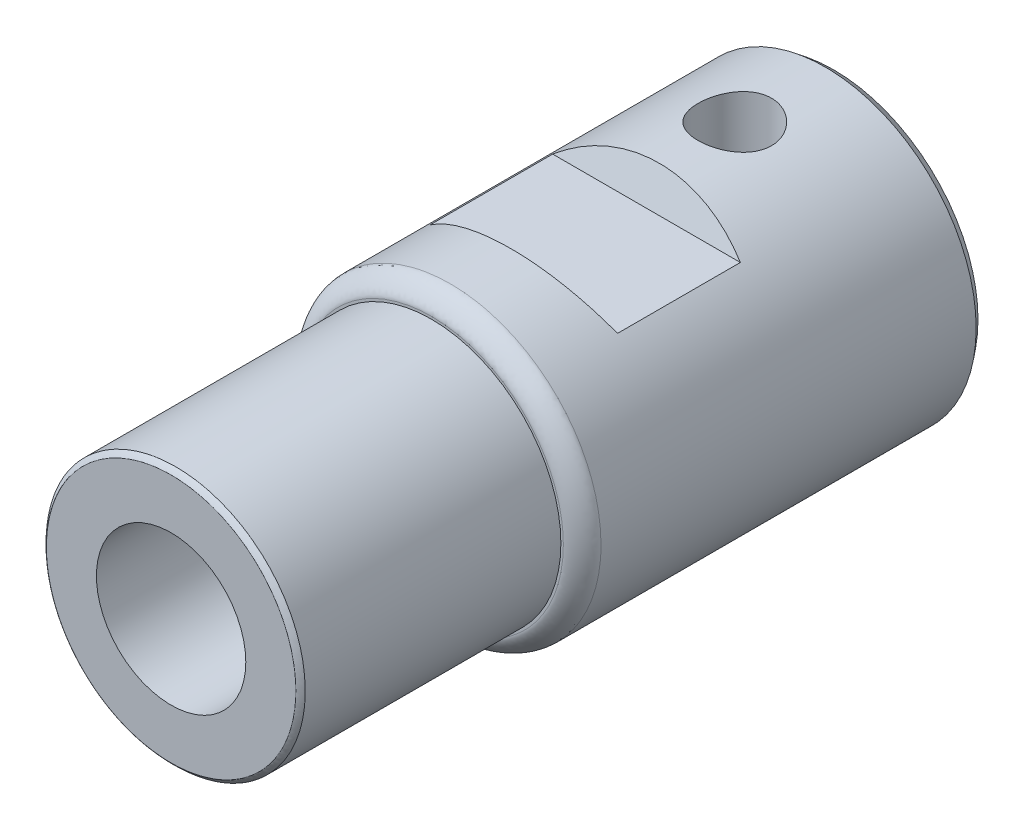
from build123d import *

# Parameters (mm, degrees)
ESBO_O1_R                                      = 8
RESSALTO_EXTRUS_O1_DEPTH                       = 35.18
ESBO_O2_R                                      = 23.44640003
ESBO_O2_R_2                                    = 6.87
CORTE_EXTRUS_O2_DEPTH                          = 13.82
FILETE1_SIZE                                   = 1
FILETE2_SIZE                                   = 0.25
CORTE_EXTRUS_O3_DEPTH                          = 25
CORTE_EXTRUS_O3_DEPTH_BACK                     = 56.82
ESBO_O5_R                                      = 3.965
CHANFRO3_SIZE                                  = 0.35
CHANFRO3_SIZE2                                 = 0.447979571
FILETE3_SIZE                                   = 0.25
BROCA_DE_ROSQUEAR_PARA_TARRAXA_DE_M3X0_5_D     = 3.9
BROCA_DE_ROSQUEAR_PARA_TARRAXA_DE_M3X0_5_DEPTH = 8.5
BROCA_DE_ROSQUEAR_PARA_TARRAXA_DE_M3_2_O_W     = 1.95
BROCA_DE_ROSQUEAR_PARA_TARRAXA_DE_M3_2_O_H     = 4.547928115
CORTE_EXTRUS_O5_DEPTH                          = 22
CORTE_EXTRUS_O5_DEPTH_BACK                     = 29


with BuildPart() as part:
    # Esboço1 → Ressalto-extrusão1 (new body)
    with BuildSketch(Plane.XY):
        with Locations(Location((0, 0, 0), (0, 0, 180))):
            Circle(ESBO_O1_R)
    extrude(amount=RESSALTO_EXTRUS_O1_DEPTH)

    # Esboço2 → Corte-extrusão2 (cut)
    with BuildSketch(Plane.XY.offset(35.18)):
        Circle(ESBO_O2_R)
        Circle(ESBO_O2_R_2, mode=Mode.SUBTRACT)
    extrude(amount=-CORTE_EXTRUS_O2_DEPTH, mode=Mode.SUBTRACT)

    # Filete1
    # a fillet whose section is not a circle: 1 mm, written as the material it takes off along each edge
    with BuildSketch(Plane(origin=(0, 0, 21.36), x_dir=(-1, 0, 0), z_dir=(0, -1, 0))) as filete1_piece_1:
        with BuildLine():
            Bezier((8, FILETE1_SIZE), (8, 0), (8 - FILETE1_SIZE, 0), weights=[1, 0.353553391, 1])
            Line((8 - FILETE1_SIZE, 0), (8, 0))
            Line((8, 0), (8, FILETE1_SIZE))
        make_face()
    revolve(axis=Axis((0, 0, 21.36), (0, 0, -1)), mode=Mode.SUBTRACT)

    # Filete2
    # a fillet whose section is not a circle: 0.25 mm, written as the material it takes off along each edge
    with BuildSketch(Plane(origin=(0, 0, 35.18), x_dir=(1, 0, 0), z_dir=(0, -1, 0))) as filete2_piece_1:
        with BuildLine():
            Bezier((6.87, -FILETE2_SIZE), (6.87, 0), (6.87 - FILETE2_SIZE, 0), weights=[1, 0.088388348, 1])
            Line((6.87 - FILETE2_SIZE, 0), (6.87, 0))
            Line((6.87, 0), (6.87, -FILETE2_SIZE))
        make_face()
    revolve(axis=Axis((0, 0, 35.18), (0, 0, 1)), mode=Mode.SUBTRACT)

    # Esboço5 → Corte-extrusão3 (cut, two sides: drawn at the far end of the back side and taken through both)
    with BuildSketch(Plane.XY.offset(35.18).offset(-CORTE_EXTRUS_O3_DEPTH_BACK)):
        Circle(ESBO_O5_R)
    extrude(amount=CORTE_EXTRUS_O3_DEPTH + CORTE_EXTRUS_O3_DEPTH_BACK, mode=Mode.SUBTRACT)

    # Chanfro3
    chanfro3_edges = [part.edges().sort_by_distance(p)[0] for p in [
        (8, 0, 0),
    ]]
    chanfro3_side = [part.faces().sort_by_distance(p)[0] for p in [
        (7.77372583, 0, 0),
    ]]
    chamfer(chanfro3_edges, length=CHANFRO3_SIZE, length2=CHANFRO3_SIZE2, reference=chanfro3_side[0])

    # Filete3
    # a fillet whose section is not a circle: 0.25 mm, written as the material it takes off along each edge
    with BuildSketch(Plane(origin=(0, 0, 0), x_dir=(1, 0, 0), z_dir=(0, -1, 0))) as filete3_piece_1:
        with BuildLine():
            Bezier((3.965 + FILETE3_SIZE, 0), (3.965, 0), (3.965, FILETE3_SIZE), weights=[1, 0.088388348, 1])
            Line((3.965, FILETE3_SIZE), (3.965, 0))
            Line((3.965, 0), (3.965 + FILETE3_SIZE, 0))
        make_face()
    revolve(axis=Axis((0, 0, 0), (0, 0, 1)), mode=Mode.SUBTRACT)

    # Broca de rosquear para tarraxa de M3x0.5
    with Locations(Plane(origin=(-0.026376137, -7.999956519, 5.248607518), x_dir=(-0.999994564824, 0.003297017064, 0), z_dir=(-0.003297017064, -0.999994564824, 0))):
        with Locations((0, 0)):
            Hole(BROCA_DE_ROSQUEAR_PARA_TARRAXA_DE_M3X0_5_D / 2, depth=BROCA_DE_ROSQUEAR_PARA_TARRAXA_DE_M3X0_5_DEPTH)

    # Broca de rosquear para tarraxa de M3 2: read off the stored shape, not the designer's step
    # Broca de rosquear para tarraxa de M3 2 o → Broca de rosquear para tarraxa de M3 2 (revolve, cut)
    with BuildSketch(Plane(origin=(0, 0, 5.254089677), x_dir=(0.9999995784373007, 0.0009182185038882269, 0), z_dir=(0, 0, -1))):
        with Locations((0.975, -5.726070555)):
            Rectangle(BROCA_DE_ROSQUEAR_PARA_TARRAXA_DE_M3_2_O_W, BROCA_DE_ROSQUEAR_PARA_TARRAXA_DE_M3_2_O_H)
    revolve(axis=Axis((0, 0, 5.254089677), (0.0009182185038882271, -0.9999995784373009, 0)), mode=Mode.SUBTRACT)

    # Esboço12 → Corte-extrusão5 (cut, two sides: drawn at the far end of the back side and taken through both)
    with BuildSketch(Plane(origin=(0, 0, 0), x_dir=(0, 0, -1), z_dir=(1, 0, 0)).offset(-CORTE_EXTRUS_O5_DEPTH_BACK)):
        Polygon((-9.944937204, 6.26), (-9.204882893, 8.170834654), (-17.204882893, 8.170834654), (-16.464828583, 6.26), align=None)
        Polygon((-9.944937204, -6.26), (-9.204882893, -8.336236341), (-17.204882893, -8.336236341), (-16.464828583, -6.26), align=None)
    extrude(amount=CORTE_EXTRUS_O5_DEPTH + CORTE_EXTRUS_O5_DEPTH_BACK, mode=Mode.SUBTRACT)


solid = part.part
